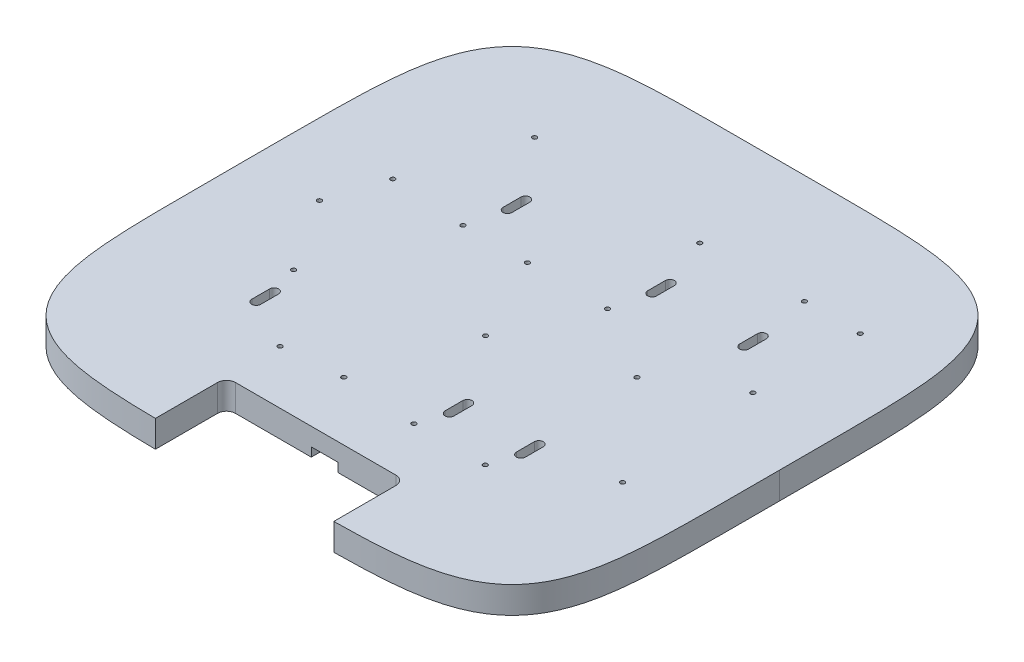
from build123d import *

# Parameters (mm, degrees)
EXTRUDE_1788_DEPTH     = 30
SKETCH_1857_R          = 2.5
CUT_EXTRUDE_1884_DEPTH = 426.323337277
CUT_EXTRUDE_2577_DEPTH = 426.323337277
CUT_EXTRUDE_START      = 10
CUT_EXTRUDE_3174_DEPTH = 10


with BuildPart() as part:
    # Sketch 1781 → Extrude 1788 (new body)
    with BuildSketch(Plane(origin=(0, 0, 0), x_dir=(1, 0, 0), z_dir=(0, 1, 0))):
        with BuildLine():
            Line((-90, -220), (90, -220))
            ThreePointArc((90, -220), (97.071067812, -222.928932188), (100, -230))
            Line((100, -230), (100, -299.752699511))
            add(Edge.make_bspline(
                [(299.999950922, 0), (299.999805192, -8.694402544), (299.999667529, -21.736035588), (300.001217481, -36.951333186), (299.99065116, -54.340218257), (299.962336101, -71.728961342), (299.875758768, -93.46518347), (299.602883242, -117.241979096), (298.679376501, -143.050585558), (297.196692477, -163.287197651), (295.58622598, -177.957343933), (293.488823304, -191.500890473), (291.134108446, -202.858139947), (288.408912089, -213.045142513), (285.410357183, -222.048680325), (282.27571239, -229.881370012), (278.620871904, -237.486995605), (274.403235391, -244.797456487), (269.595972653, -251.736262834), (264.19540074, -258.225391709), (258.225413369, -264.195385619), (251.736290224, -269.595963991), (244.797488667, -274.403233136), (237.487031812, -278.620875987), (229.881409486, -282.275722517), (222.048722342, -285.410372899), (213.045186685, -288.408933496), (202.858185777, -291.134135293), (191.500937546, -293.488855196), (177.957391812, -295.586262487), (163.287246128, -297.196732944), (143.050634387, -298.679420744), (124.850055244, -299.330692316), (110.859628638, -299.611028911), (101.083006334, -299.739273014), (100, -299.752699511)],
                knots=[0, 0, 0, 0, 0, 0.064453125, 0.096679688, 0.112792969, 0.12890625, 0.193359375, 0.2578125, 0.2890625, 0.3203125, 0.34375, 0.3671875, 0.390625, 0.40625, 0.421875, 0.4375, 0.453125, 0.46875, 0.484375, 0.5, 0.515625, 0.53125, 0.546875, 0.5625, 0.578125, 0.59375, 0.609375, 0.6328125, 0.65625, 0.6796875, 0.7109375, 0.7421875, 0.806640625, 0.814669783, 0.814669783, 0.814669783, 0.814669783, 0.814669783], degree=4))
            add(Edge.make_bspline(
                [(299.999950922, 0), (299.999803769, 8.694402544), (299.999663973, 21.736035588), (300.001211436, 36.951333186), (299.99064227, 54.340218255), (299.962324366, 71.728961336), (299.875743478, 93.465183449), (299.602864063, 117.241979031), (298.679353099, 143.050585342), (297.196665764, 163.287197192), (295.586196868, 177.957343211), (293.488791976, 191.500889408), (291.13407526, 202.858138497), (288.408877236, 213.045140617), (285.410320857, 222.048677938), (282.275674783, 229.881367112), (278.620833053, 237.486992108), (274.403195344, 244.7974523), (269.595931471, 251.73625786), (264.195358497, 258.225385851), (258.225370149, 264.195378785), (251.73624612, 269.595956096), (244.797443777, 274.403224105), (237.486986232, 278.620865761), (229.881363308, 282.275711046), (222.048675651, 285.410360147), (213.045139504, 288.40891927), (202.85813815, 291.134119401), (191.500889533, 293.488837446), (177.957343457, 295.586242522), (163.287197509, 297.196710579), (143.050585526, 298.679395068), (117.241979065, 299.602900558), (93.465183554, 299.875773298), (71.728961216, 299.962347549), (54.340218396, 299.990659976), (36.951333084, 300.001223545), (21.73603502, 299.999670958), (8.694402191, 299.999806536), (0, 299.999950922)],
                knots=[0, 0, 0, 0, 0, 0.064453125, 0.096679688, 0.112792969, 0.12890625, 0.193359375, 0.2578125, 0.2890625, 0.3203125, 0.34375, 0.3671875, 0.390625, 0.40625, 0.421875, 0.4375, 0.453125, 0.46875, 0.484375, 0.5, 0.515625, 0.53125, 0.546875, 0.5625, 0.578125, 0.59375, 0.609375, 0.6328125, 0.65625, 0.6796875, 0.7109375, 0.7421875, 0.806640625, 0.87109375, 0.887207031, 0.903320312, 0.935546875, 1, 1, 1, 1, 1], degree=4))
            add(Edge.make_bspline(
                [(-299.999950922, 0), (-299.999803769, 8.694402544), (-299.999663973, 21.736035588), (-300.001211436, 36.951333186), (-299.99064227, 54.340218255), (-299.962324366, 71.728961336), (-299.875743478, 93.465183449), (-299.602864063, 117.241979031), (-298.679353099, 143.050585342), (-297.196665764, 163.287197192), (-295.586196868, 177.957343211), (-293.488791976, 191.500889408), (-291.13407526, 202.858138497), (-288.408877236, 213.045140617), (-285.410320857, 222.048677938), (-282.275674783, 229.881367112), (-278.620833053, 237.486992108), (-274.403195344, 244.7974523), (-269.595931471, 251.73625786), (-264.195358497, 258.225385851), (-258.225370149, 264.195378785), (-251.73624612, 269.595956096), (-244.797443777, 274.403224105), (-237.486986232, 278.620865761), (-229.881363308, 282.275711046), (-222.048675651, 285.410360147), (-213.045139504, 288.40891927), (-202.85813815, 291.134119401), (-191.500889533, 293.488837446), (-177.957343457, 295.586242522), (-163.287197509, 297.196710579), (-143.050585526, 298.679395068), (-117.241979065, 299.602900558), (-93.465183554, 299.875773298), (-71.728961216, 299.962347549), (-54.340218396, 299.990659976), (-36.951333084, 300.001223545), (-21.73603502, 299.999670958), (-8.694402191, 299.999806536), (0, 299.999950922)],
                knots=[0, 0, 0, 0, 0, 0.064453125, 0.096679688, 0.112792969, 0.12890625, 0.193359375, 0.2578125, 0.2890625, 0.3203125, 0.34375, 0.3671875, 0.390625, 0.40625, 0.421875, 0.4375, 0.453125, 0.46875, 0.484375, 0.5, 0.515625, 0.53125, 0.546875, 0.5625, 0.578125, 0.59375, 0.609375, 0.6328125, 0.65625, 0.6796875, 0.7109375, 0.7421875, 0.806640625, 0.87109375, 0.887207031, 0.903320312, 0.935546875, 1, 1, 1, 1, 1], degree=4))
            add(Edge.make_bspline(
                [(-299.999950922, 0), (-299.999805192, -8.694402544), (-299.999667529, -21.736035588), (-300.001217481, -36.951333186), (-299.99065116, -54.340218257), (-299.962336101, -71.728961342), (-299.875758768, -93.46518347), (-299.602883242, -117.241979096), (-298.679376501, -143.050585558), (-297.196692477, -163.287197651), (-295.58622598, -177.957343933), (-293.488823304, -191.500890473), (-291.134108446, -202.858139947), (-288.408912089, -213.045142513), (-285.410357183, -222.048680325), (-282.27571239, -229.881370012), (-278.620871904, -237.486995605), (-274.403235391, -244.797456487), (-269.595972653, -251.736262834), (-264.19540074, -258.225391709), (-258.225413369, -264.195385619), (-251.736290224, -269.595963991), (-244.797488667, -274.403233136), (-237.487031812, -278.620875987), (-229.881409486, -282.275722517), (-222.048722342, -285.410372899), (-213.045186685, -288.408933496), (-202.858185777, -291.134135293), (-191.500937546, -293.488855196), (-177.957391812, -295.586262487), (-163.287246128, -297.196732944), (-143.050634387, -298.679420744), (-124.850055244, -299.330692316), (-110.859628638, -299.611028911), (-101.083006334, -299.739273014), (-100, -299.752699511)],
                knots=[0, 0, 0, 0, 0, 0.064453125, 0.096679688, 0.112792969, 0.12890625, 0.193359375, 0.2578125, 0.2890625, 0.3203125, 0.34375, 0.3671875, 0.390625, 0.40625, 0.421875, 0.4375, 0.453125, 0.46875, 0.484375, 0.5, 0.515625, 0.53125, 0.546875, 0.5625, 0.578125, 0.59375, 0.609375, 0.6328125, 0.65625, 0.6796875, 0.7109375, 0.7421875, 0.806640625, 0.814669783, 0.814669783, 0.814669783, 0.814669783, 0.814669783], degree=4))
            Line((-100, -299.752699511), (-100, -230))
            ThreePointArc((-100, -230), (-97.071067812, -222.928932188), (-90, -220))
        make_face()
    extrude(amount=-EXTRUDE_1788_DEPTH)

    # Sketch 1857 → Cut-Extrude 1884 (cut, through all)
    with BuildSketch(Plane(origin=(0, 0, 0), x_dir=(1, 0, 0), z_dir=(0, 1, 0))):
        with Locations((-115, 60)):
            Circle(SKETCH_1857_R)
        with Locations((47, 60)):
            Circle(SKETCH_1857_R)
        with Locations((210, 60)):
            Circle(SKETCH_1857_R)
        with Locations((-100, -160)):
            Circle(SKETCH_1857_R)
        with Locations((50, -160)):
            Circle(SKETCH_1857_R)
        with Locations((130, -160)):
            Circle(SKETCH_1857_R)
        with Locations((-42.72, 60)):
            Circle(SKETCH_1857_R)
        with Locations((-199.29, 65.75)):
            Circle(SKETCH_1857_R)
        with Locations((-160.19, 185.5)):
            Circle(SKETCH_1857_R)
        with Locations((34.806763, 175.55)):
            Circle(SKETCH_1857_R)
        with Locations((150.216186, 177.55)):
            Circle(SKETCH_1857_R)
        with Locations((212.76, 177.55)):
            Circle(SKETCH_1857_R)
        with Locations((-166.666763, -78.149039)):
            Circle(SKETCH_1857_R)
        with Locations((-219.52, 3.7)):
            Circle(SKETCH_1857_R)
        with Locations((-34.29, -154.25)):
            Circle(SKETCH_1857_R)
        with Locations((4.81, -34.5)):
            Circle(SKETCH_1857_R)
        with Locations((223.895, -100)):
            Circle(SKETCH_1857_R)
        with Locations((130, 10)):
            Circle(SKETCH_1857_R)
    extrude(amount=-CUT_EXTRUDE_1884_DEPTH, mode=Mode.SUBTRACT)

    # Sketch 1924 → Cut-Extrude 2577 (cut, through all)
    with BuildSketch(Plane(origin=(0, 0, 0), x_dir=(1, 0, 0), z_dir=(0, 1, 0))):
        with BuildLine():
            Line((-100, 120), (-100, 100))
            ThreePointArc((-100, 100), (-105, 95), (-110, 100))
            Line((-110, 100), (-110, 120))
            ThreePointArc((-110, 120), (-105, 125), (-100, 120))
        make_face()
        with BuildLine():
            Line((62, 120), (62, 100))
            ThreePointArc((62, 100), (57, 95), (52, 100))
            Line((52, 100), (52, 120))
            ThreePointArc((52, 120), (57, 125), (62, 120))
        make_face()
        with BuildLine():
            Line((165.216186, 120), (165.216186, 100))
            ThreePointArc((165.216186, 100), (160.216186, 95), (155.216186, 100))
            Line((155.216186, 100), (155.216186, 120))
            ThreePointArc((155.216186, 120), (160.216186, 125), (165.216186, 120))
        make_face()
        with BuildLine():
            Line((-151.666763, -110), (-151.666763, -130))
            ThreePointArc((-151.666763, -130), (-156.666763, -135), (-161.666763, -130))
            Line((-161.666763, -130), (-161.666763, -110))
            ThreePointArc((-161.666763, -110), (-156.666763, -105), (-151.666763, -110))
        make_face()
        with BuildLine():
            Line((65, -110), (65, -130))
            ThreePointArc((65, -130), (60, -135), (55, -130))
            Line((55, -130), (55, -110))
            ThreePointArc((55, -110), (60, -105), (65, -110))
        make_face()
        with BuildLine():
            Line((145, -110), (145, -130))
            ThreePointArc((145, -130), (140, -135), (135, -130))
            Line((135, -130), (135, -110))
            ThreePointArc((135, -110), (140, -105), (145, -110))
        make_face()
    extrude(amount=-CUT_EXTRUDE_2577_DEPTH, mode=Mode.SUBTRACT)

    # Sketch 2635 → Cut-Extrude 3174 (cut)
    with BuildSketch(Plane(origin=(0, -30, 0), x_dir=(1, 0, 0), z_dir=(0, 1, 0)).offset(CUT_EXTRUDE_START)):
        with BuildLine():
            Line((-105, 95), (70, 95))
            ThreePointArc((70, 95), (73.535533906, 93.535533906), (75, 90))
            Line((75, 90), (75, -100))
            ThreePointArc((75, -100), (73.535533906, -103.535533906), (70, -105))
            Line((70, -105), (-156.666763, -105))
            ThreePointArc((-156.666763, -105), (-160.202296906, -106.464466094), (-161.666763, -110))
            Line((-161.666763, -110), (-161.666763, -130))
            ThreePointArc((-161.666763, -130), (-160.202296906, -133.535533906), (-156.666763, -135))
            Line((-156.666763, -135), (-10, -135))
            ThreePointArc((-10, -135), (-6.464466094, -136.464466094), (-5, -140))
            Line((-5, -140), (-5, -220))
            Line((-5, -220), (25, -220))
            Line((25, -220), (25, -140))
            ThreePointArc((25, -140), (26.464466094, -136.464466094), (30, -135))
            Line((30, -135), (140, -135))
            ThreePointArc((140, -135), (143.535533906, -133.535533906), (145, -130))
            Line((145, -130), (145, -110))
            ThreePointArc((145, -110), (143.535533906, -106.464466094), (140, -105))
            Line((140, -105), (110, -105))
            ThreePointArc((110, -105), (106.464466094, -103.535533906), (105, -100))
            Line((105, -100), (105, 90))
            ThreePointArc((105, 90), (106.464466094, 93.535533906), (110, 95))
            Line((110, 95), (160.216186, 95))
            ThreePointArc((160.216186, 95), (163.751719906, 96.464466094), (165.216186, 100))
            Line((165.216186, 100), (165.216186, 120))
            ThreePointArc((165.216186, 120), (163.751719906, 123.535533906), (160.216186, 125))
            Line((160.216186, 125), (-105, 125))
            ThreePointArc((-105, 125), (-108.535533906, 123.535533906), (-110, 120))
            Line((-110, 120), (-110, 100))
            ThreePointArc((-110, 100), (-108.535533906, 96.464466094), (-105, 95))
        make_face()
    extrude(amount=-CUT_EXTRUDE_3174_DEPTH, mode=Mode.SUBTRACT)


solid = part.part
